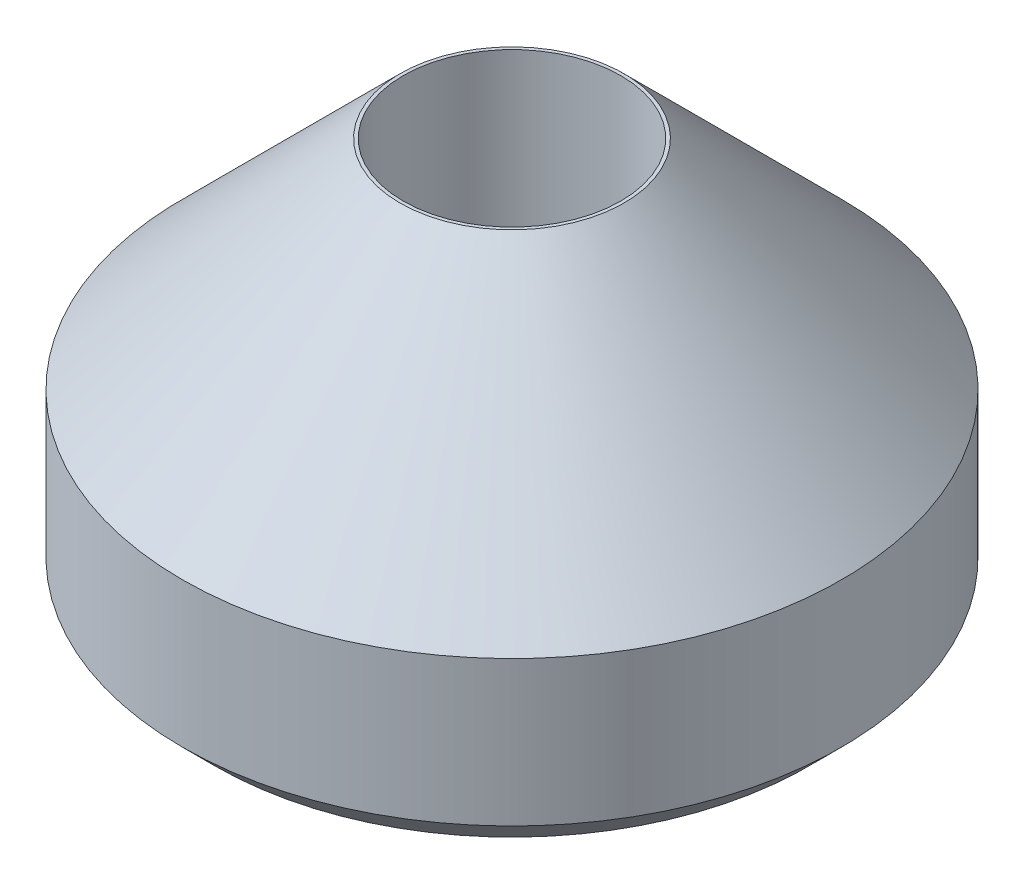
from build123d import *

# Parameters (mm, degrees)
SKETCH1_R           = 5
BOSS_EXTRUDE1_DEPTH = 1
SKETCH2_R           = 5
BOSS_EXTRUDE2_DEPTH = 5
SKETCH3_R           = 1.65
CUT_EXTRUDE3_DEPTH  = 3
CHAMFER3_SIZE       = 3.3
CHAMFER4_SIZE       = 0.5
SKETCH4_W           = 1
SKETCH4_H           = 3.5
CUT_EXTRUDE4_DEPTH  = 1
FILLET1_R           = 0.5


with BuildPart() as part:
    # Sketch1 → Boss-Extrude1 (new body)
    with BuildSketch(Plane(origin=(0, 0, 0), x_dir=(1, 0, 0), z_dir=(0, 1, 0))):
        with Locations(Location((0, 0, 0), (0, 0, 270))):
            Circle(SKETCH1_R)
    extrude(amount=BOSS_EXTRUDE1_DEPTH)

    # Sketch2 → Boss-Extrude2 (add)
    with BuildSketch(Plane(origin=(0, 1, 0), x_dir=(1, 0, 0), z_dir=(0, 1, 0))):
        with Locations(Location((0, 0, 0), (0, 0, 270))):
            Circle(SKETCH2_R)
    extrude(amount=BOSS_EXTRUDE2_DEPTH)

    # Sketch3 → Cut-Extrude3 (cut)
    with BuildSketch(Plane(origin=(0, 6, 0), x_dir=(1, 0, 0), z_dir=(0, 1, 0))):
        with Locations(Location((0, 0, 0), (0, 0, 270))):
            Circle(SKETCH3_R)
    extrude(amount=-CUT_EXTRUDE3_DEPTH, mode=Mode.SUBTRACT)

    # Chamfer3
    chamfer3_edges = [part.edges().sort_by_distance(p)[0] for p in [
        (0, 6, -5),
    ]]
    chamfer(chamfer3_edges, length=CHAMFER3_SIZE)

    # Chamfer4
    chamfer4_edges = [part.edges().sort_by_distance(p)[0] for p in [
        (0, 0, -5),
    ]]
    chamfer(chamfer4_edges, length=CHAMFER4_SIZE)

    # Sketch4 → Cut-Extrude4 (cut)
    with BuildSketch(Plane.XZ):
        with BuildLine():
            Line((-2.007517527, -2.867032155), (-1.433941091, -2.047880111))
            ThreePointArc((-1.433941091, -2.047880111), (0, 2.5), (1.433941091, -2.047880111))
            Line((1.433941091, -2.047880111), (2.007517527, -2.867032155))
            ThreePointArc((2.007517527, -2.867032155), (0, 3.5), (-2.007517527, -2.867032155))
        make_face()
        with Locations((0, -1.75)):
            Rectangle(SKETCH4_W, SKETCH4_H)
    extrude(amount=-CUT_EXTRUDE4_DEPTH, mode=Mode.SUBTRACT)

    # Fillet1
    fillet1_edges = [part.edges().sort_by_distance(p)[0] for p in [
        (1.433941091, 0.5, -2.047880111),
        (2.007517527, 0.5, -2.867032155),
        (0.5, 0.5, -3.5),
        (0.5, 0.5, 0),
        (-0.5, 0.5, 0),
        (-0.5, 0.5, -3.5),
        (-1.433941091, 0.5, -2.047880111),
        (-2.007517527, 0.5, -2.867032155),
    ]]
    fillet(fillet1_edges, radius=FILLET1_R - 0.0001)  # a hair under: the kernel refuses the full size


solid = part.part
